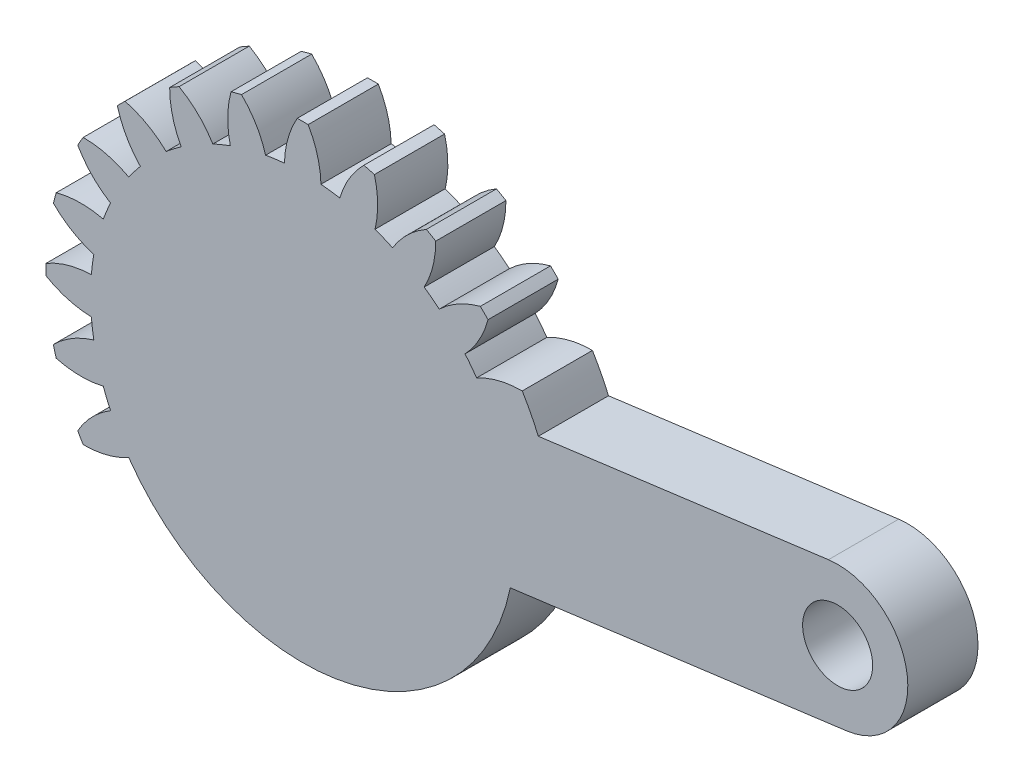
from build123d import *

# Parameters (mm, degrees)
SKETCH2_R           = 1.75
SKETCH2_R_2         = 1.995
BOSS_EXTRUDE1_DEPTH = 4
SKETCH4_R           = 1.3
SKETCH4_R_2         = 2.4
CUT_EXTRUDE1_DEPTH  = 38.915688046
SKETCH6_R           = 12.09
BOSS_EXTRUDE3_DEPTH = 4
CUT_EXTRUDE5_DEPTH  = 4
SKETCH10_W          = 77.083207297
SKETCH10_H          = 41.615870942
CUT_EXTRUDE6_DEPTH  = 4
CIRPATTERN3_START   = 4
CIRPATTERN3_DEPTH   = 4
SKETCH11_R          = 1.995
CUT_EXTRUDE7_DEPTH  = 4
CUT_EXTRUDE8_DEPTH  = 4


# Read off the part's stored shape, not the designer's step: CirPattern3
with BuildPart() as part:
    # Sketch2 → Boss-Extrude1 (new body)
    with BuildSketch(Plane.XY):
        with BuildLine():
            ThreePointArc((30.75, -4), (34.75, 0), (30.75, 4))
            Line((30.75, 4), (14.072558403, 4))
            ThreePointArc((14.072558403, 4), (14.06038767, 4.04257326), (14.048088143, 4.085109489))
            ThreePointArc((14.048088143, 4.085109489), (12.709169027, 4.272836063), (11.365584201, 4.122086336))
            ThreePointArc((11.365584201, 4.122086336), (11.169703548, 4.626642697), (10.951436862, 5.12192646))
            ThreePointArc((10.951436862, 5.12192646), (12.008090957, 5.965388247), (12.82210701, 7.044889767))
            ThreePointArc((12.82210701, 7.044889767), (12.669951657, 7.315), (12.51210701, 7.581825517))
            ThreePointArc((12.51210701, 7.581825517), (11.170223244, 7.416617696), (9.911436862, 6.9232593))
            ThreePointArc((9.911436862, 6.9232593), (9.591641884, 7.359925677), (9.252623584, 7.781841479))
            ThreePointArc((9.252623584, 7.781841479), (10.05496909, 8.870045207), (10.561852666, 10.123446462))
            ThreePointArc((10.561852666, 10.123446462), (10.344972209, 10.344972209), (10.123446462, 10.561852666))
            ThreePointArc((10.123446462, 10.561852666), (8.870045207, 10.05496909), (7.781841479, 9.252623584))
            ThreePointArc((7.781841479, 9.252623584), (7.359925677, 9.591641884), (6.9232593, 9.911436862))
            ThreePointArc((6.9232593, 9.911436862), (7.416617696, 11.170223244), (7.581825517, 12.51210701))
            ThreePointArc((7.581825517, 12.51210701), (7.315, 12.669951657), (7.044889767, 12.82210701))
            ThreePointArc((7.044889767, 12.82210701), (5.965388247, 12.008090957), (5.12192646, 10.951436862))
            ThreePointArc((5.12192646, 10.951436862), (4.626642697, 11.169703548), (4.122086336, 11.365584201))
            ThreePointArc((4.122086336, 11.365584201), (4.272836063, 12.709169027), (4.085109489, 14.048088143))
            ThreePointArc((4.085109489, 14.048088143), (3.78652263, 14.131494839), (3.486235477, 14.208555951))
            ThreePointArc((3.486235477, 14.208555951), (2.654199937, 13.14288127), (2.112960617, 11.903927815))
            ThreePointArc((2.112960617, 11.903927815), (1.578061664, 11.986568374), (1.04, 12.04518576))
            ThreePointArc((1.04, 12.04518576), (0.837867713, 13.382005944), (0.31, 14.626715284))
            ThreePointArc((0.31, 14.626715284), (0, 14.63), (-0.31, 14.626715284))
            ThreePointArc((-0.31, 14.626715284), (-0.837867713, 13.382005944), (-1.04, 12.04518576))
            ThreePointArc((-1.04, 12.04518576), (-1.578061664, 11.986568374), (-2.112960617, 11.903927815))
            ThreePointArc((-2.112960617, 11.903927815), (-2.654199937, 13.14288127), (-3.486235477, 14.208555951))
            ThreePointArc((-3.486235477, 14.208555951), (-3.78652263, 14.131494839), (-4.085109489, 14.048088143))
            ThreePointArc((-4.085109489, 14.048088143), (-4.272836063, 12.709169027), (-4.122086336, 11.365584201))
            ThreePointArc((-4.122086336, 11.365584201), (-4.626642697, 11.169703548), (-5.12192646, 10.951436862))
            ThreePointArc((-5.12192646, 10.951436862), (-5.965388247, 12.008090957), (-7.044889767, 12.82210701))
            ThreePointArc((-7.044889767, 12.82210701), (-7.315, 12.669951657), (-7.581825517, 12.51210701))
            ThreePointArc((-7.581825517, 12.51210701), (-7.416617696, 11.170223244), (-6.9232593, 9.911436862))
            ThreePointArc((-6.9232593, 9.911436862), (-7.359925677, 9.591641884), (-7.781841479, 9.252623584))
            ThreePointArc((-7.781841479, 9.252623584), (-8.870045207, 10.05496909), (-10.123446462, 10.561852666))
            ThreePointArc((-10.123446462, 10.561852666), (-10.344972209, 10.344972209), (-10.561852666, 10.123446462))
            ThreePointArc((-10.561852666, 10.123446462), (-10.05496909, 8.870045207), (-9.252623584, 7.781841479))
            ThreePointArc((-9.252623584, 7.781841479), (-9.591641884, 7.359925677), (-9.911436862, 6.9232593))
            ThreePointArc((-9.911436862, 6.9232593), (-11.170223244, 7.416617696), (-12.51210701, 7.581825517))
            ThreePointArc((-12.51210701, 7.581825517), (-12.669951657, 7.315), (-12.82210701, 7.044889767))
            ThreePointArc((-12.82210701, 7.044889767), (-12.008090957, 5.965388247), (-10.951436862, 5.12192646))
            ThreePointArc((-10.951436862, 5.12192646), (-11.169703548, 4.626642697), (-11.365584201, 4.122086336))
            ThreePointArc((-11.365584201, 4.122086336), (-12.709169027, 4.272836063), (-14.048088143, 4.085109489))
            ThreePointArc((-14.048088143, 4.085109489), (-14.131494839, 3.78652263), (-14.208555951, 3.486235477))
            ThreePointArc((-14.208555951, 3.486235477), (-13.14288127, 2.654199937), (-11.903927815, 2.112960617))
            ThreePointArc((-11.903927815, 2.112960617), (-11.986568374, 1.578061664), (-12.04518576, 1.04))
            ThreePointArc((-12.04518576, 1.04), (-13.382005944, 0.837867713), (-14.626715284, 0.31))
            ThreePointArc((-14.626715284, 0.31), (-14.63, 0), (-14.626715284, -0.31))
            ThreePointArc((-14.626715284, -0.31), (-13.382005944, -0.837867713), (-12.04518576, -1.04))
            ThreePointArc((-12.04518576, -1.04), (-11.986568374, -1.578061664), (-11.903927815, -2.112960617))
            ThreePointArc((-11.903927815, -2.112960617), (-13.14288127, -2.654199937), (-14.208555951, -3.486235477))
            ThreePointArc((-14.208555951, -3.486235477), (-14.131494839, -3.78652263), (-14.048088143, -4.085109489))
            ThreePointArc((-14.048088143, -4.085109489), (-12.709169027, -4.272836063), (-11.365584201, -4.122086336))
            ThreePointArc((-11.365584201, -4.122086336), (0.064808849, -12.089826294), (11.409123542, -4))
            Line((11.409123542, -4), (30.75, -4))
        make_face()
        Circle(SKETCH2_R, mode=Mode.SUBTRACT)
        with Locations((30.75, 0)):
            Circle(SKETCH2_R_2, mode=Mode.SUBTRACT)
    extrude(amount=BOSS_EXTRUDE1_DEPTH)

    # Sketch4 → Cut-Extrude1 (cut, through all)
    with BuildSketch(Plane.XY.offset(4)):
        with Locations((4.5, 0)):
            Circle(SKETCH4_R)
        with Locations((-4.5, 0)):
            Circle(SKETCH4_R)
        Circle(SKETCH4_R_2)
    extrude(amount=-CUT_EXTRUDE1_DEPTH, mode=Mode.SUBTRACT)

    # Sketch6 → Boss-Extrude3 (add)
    with BuildSketch(Plane.XY.offset(4)):
        with BuildLine():
            Line((-0.522104769, 3.965779445), (0, 4.034515842))
            Line((0, 4.034515842), (0, 12.09))
            ThreePointArc((0, 12.09), (-9.383764517, -7.623192474), (11.833621678, -2.476589993))
            Line((11.833621678, -2.476589993), (0.522104769, -3.965779445))
            ThreePointArc((0.522104769, -3.965779445), (-3.965779445, -0.522104769), (-0.522104769, 3.965779445))
        make_face()
        with BuildLine():
            Line((0, 12.09), (0, 4.034515842))
            Line((0, 4.034515842), (1.120574863, 4.182042322))
            Line((1.120574863, 4.182042322), (3.129122255, 11.67804324))
            ThreePointArc((3.129122255, 11.67804324), (1.578061664, 11.986568374), (0, 12.09))
        make_face()
        with BuildLine():
            Line((3.129122255, 11.67804324), (1.120574863, 4.182042322))
            Line((1.120574863, 4.182042322), (10.78941214, 5.454968898))
            ThreePointArc((10.78941214, 5.454968898), (7.623192474, 9.383764517), (3.129122255, 11.67804324))
        make_face()
        with BuildLine():
            Line((1.120574863, 4.182042322), (0, 0))
            Line((0, 0), (0, 4.034515842))
            Line((0, 4.034515842), (-0.522104769, 3.965779445))
            ThreePointArc((-0.522104769, 3.965779445), (-3.965779445, -0.522104769), (0.522104769, -3.965779445))
            Line((0.522104769, -3.965779445), (11.833621678, -2.476589993))
            ThreePointArc((11.833621678, -2.476589993), (12.025734615, -1.24491243), (12.09, 0))
            ThreePointArc((12.09, 0), (11.76035911, 2.80393538), (10.78941214, 5.454968898))
            Line((10.78941214, 5.454968898), (1.120574863, 4.182042322))
        make_face()
        with BuildLine():
            Line((13.430060946, 5.802616909), (10.78941214, 5.454968898))
            ThreePointArc((10.78941214, 5.454968898), (11.76035911, 2.80393538), (12.09, 0))
            ThreePointArc((12.09, 0), (12.025734615, -1.24491243), (11.833621678, -2.476589993))
            Line((11.833621678, -2.476589993), (14.474270484, -2.128941982))
            ThreePointArc((14.474270484, -2.128941982), (14.59101568, -1.067315048), (14.63, 0))
            ThreePointArc((14.63, 0), (14.32687495, 2.962693737), (13.430060946, 5.802616909))
        make_face()
        with BuildLine():
            Line((29.964824718, 7.979459856), (13.430060946, 5.802616909))
            ThreePointArc((13.430060946, 5.802616909), (14.32687495, 2.962693737), (14.63, 0))
            ThreePointArc((14.63, 0), (14.59101568, -1.067315048), (14.474270484, -2.128941982))
            Line((14.474270484, -2.128941982), (31.009034256, 0.047900965))
            ThreePointArc((31.009034256, 0.047900965), (34.452708933, 4.53578518), (29.964824718, 7.979459856))
        make_face()
        with BuildLine():
            Line((3.78652263, 14.131494839), (3.129122255, 11.67804324))
            ThreePointArc((3.129122255, 11.67804324), (7.623192474, 9.383764517), (10.78941214, 5.454968898))
            Line((10.78941214, 5.454968898), (13.430060946, 5.802616909))
            ThreePointArc((13.430060946, 5.802616909), (9.562700424, 11.07211184), (3.78652263, 14.131494839))
        make_face()
        Circle(SKETCH6_R)
        with BuildLine():
            Line((0, 0), (3.78652263, 14.131494839))
            ThreePointArc((3.78652263, 14.131494839), (1.909598192, 14.504838322), (0, 14.63))
            Line((0, 14.63), (0, 0))
        make_face()
        with BuildLine():
            ThreePointArc((11.833621678, -2.476589993), (-9.383764517, -7.623192474), (0, 12.09))
            Line((0, 12.09), (0, 14.63))
            ThreePointArc((0, 14.63), (-11.07211184, -9.562700424), (14.474270484, -2.128941982))
            Line((14.474270484, -2.128941982), (11.833621678, -2.476589993))
        make_face()
        Polygon((0, 4.034515842), (0, 0), (1.120574863, 4.182042322), align=None)
    extrude(amount=BOSS_EXTRUDE3_DEPTH)

    # Sketch7 → Cut-Extrude5 (cut)
    with BuildSketch(Plane.XY.offset(4)):
        with BuildLine():
            ThreePointArc((9.911436862, 6.9232593), (11.170223244, 7.416617696), (12.51210701, 7.581825517))
            ThreePointArc((12.51210701, 7.581825517), (11.606759368, 8.906179706), (10.561852666, 10.123446462))
            ThreePointArc((10.561852666, 10.123446462), (10.05496909, 8.870045207), (9.252623584, 7.781841479))
            ThreePointArc((9.252623584, 7.781841479), (9.591641884, 7.359925677), (9.911436862, 6.9232593))
        make_face()
    extrude(amount=CUT_EXTRUDE5_DEPTH, mode=Mode.SUBTRACT)

    # Sketch10 → Cut-Extrude6 (cut)
    # profile 1 of 2: a face of its own
    with BuildSketch(Plane(origin=(0, 0, 0), x_dir=(-1, 0, 0), z_dir=(0, 0, -1))):
        with Locations((-5.704161283, 1.736795553)):
            Rectangle(SKETCH10_W, SKETCH10_H)
        Polygon((-12.51210701, 7.581825517), (-10.123446462, 10.561852666), (0, 0), align=None, mode=Mode.SUBTRACT)
    # profile 2 of 2: a face of its own
    with BuildSketch(Plane(origin=(0, 0, 0), x_dir=(-1, 0, 0), z_dir=(0, 0, -1))):
        Polygon((-10.123446462, 10.561852666), (0, 0), (-12.51210701, 7.581825517), align=None)
    extrude(amount=-CUT_EXTRUDE6_DEPTH, mode=Mode.SUBTRACT)

    # CirPattern3 outline → CirPattern3 (cut)
    with BuildSketch(Plane.XY.offset(CIRPATTERN3_START)):
        with BuildLine():
            ThreePointArc((-12.82210701, -7.044889767), (-12.008090957, -5.965388247), (-10.951436862, -5.12192646))
            ThreePointArc((-10.951436862, -5.12192646), (-11.169703548, -4.626642697), (-11.365584201, -4.122086336))
            ThreePointArc((-11.365584201, -4.122086336), (-12.709169027, -4.272836063), (-14.048088143, -4.085109489))
            ThreePointArc((-14.048088143, -4.085109489), (-13.516357561, -5.598658615), (-12.82210701, -7.044889767))
        make_face()
        with BuildLine():
            ThreePointArc((10.123446462, 10.561852666), (8.906179707, 11.606759369), (7.581825517, 12.51210701))
            ThreePointArc((7.581825517, 12.51210701), (7.416617696, 11.170223245), (6.9232593, 9.911436862))
            ThreePointArc((6.9232593, 9.911436862), (7.359925677, 9.591641884), (7.781841479, 9.252623584))
            ThreePointArc((7.781841479, 9.252623584), (8.870045207, 10.05496909), (10.123446462, 10.561852666))
        make_face()
        with BuildLine():
            ThreePointArc((7.044889767, 12.82210701), (5.598658616, 13.516357561), (4.085109489, 14.048088143))
            ThreePointArc((4.085109489, 14.048088143), (4.272836063, 12.709169027), (4.122086336, 11.365584201))
            ThreePointArc((4.122086336, 11.365584201), (4.626642697, 11.169703548), (5.12192646, 10.951436862))
            ThreePointArc((5.12192646, 10.951436862), (5.965388247, 12.008090957), (7.044889767, 12.82210701))
        make_face()
        with BuildLine():
            ThreePointArc((3.486235477, 14.208555951), (1.909598192, 14.504838322), (0.31, 14.626715284))
            ThreePointArc((0.31, 14.626715284), (0.837867713, 13.382005944), (1.04, 12.04518576))
            ThreePointArc((1.04, 12.04518576), (1.578061664, 11.986568374), (2.112960617, 11.903927815))
            ThreePointArc((2.112960617, 11.903927815), (2.654199937, 13.14288127), (3.486235477, 14.208555951))
        make_face()
        with BuildLine():
            ThreePointArc((-0.31, 14.626715284), (-1.909598192, 14.504838322), (-3.486235477, 14.208555951))
            ThreePointArc((-3.486235477, 14.208555951), (-2.654199937, 13.14288127), (-2.112960617, 11.903927815))
            ThreePointArc((-2.112960617, 11.903927815), (-1.578061664, 11.986568374), (-1.04, 12.04518576))
            ThreePointArc((-1.04, 12.04518576), (-0.837867713, 13.382005944), (-0.31, 14.626715284))
        make_face()
        with BuildLine():
            ThreePointArc((-4.085109489, 14.048088143), (-5.598658616, 13.516357561), (-7.044889767, 12.82210701))
            ThreePointArc((-7.044889767, 12.82210701), (-5.965388247, 12.008090957), (-5.12192646, 10.951436862))
            ThreePointArc((-5.12192646, 10.951436862), (-4.626642697, 11.169703548), (-4.122086336, 11.365584201))
            ThreePointArc((-4.122086336, 11.365584201), (-4.272836063, 12.709169027), (-4.085109489, 14.048088143))
        make_face()
        with BuildLine():
            ThreePointArc((-7.581825517, 12.51210701), (-8.906179706, 11.606759368), (-10.123446462, 10.561852666))
            ThreePointArc((-10.123446462, 10.561852666), (-8.870045207, 10.05496909), (-7.781841479, 9.252623584))
            ThreePointArc((-7.781841479, 9.252623584), (-7.359925677, 9.591641884), (-6.9232593, 9.911436862))
            ThreePointArc((-6.9232593, 9.911436862), (-7.416617696, 11.170223245), (-7.581825517, 12.51210701))
        make_face()
        with BuildLine():
            ThreePointArc((-10.561852666, 10.123446462), (-11.606759368, 8.906179706), (-12.51210701, 7.581825517))
            ThreePointArc((-12.51210701, 7.581825517), (-11.170223245, 7.416617696), (-9.911436862, 6.9232593))
            ThreePointArc((-9.911436862, 6.9232593), (-9.591641884, 7.359925677), (-9.252623584, 7.781841479))
            ThreePointArc((-9.252623584, 7.781841479), (-10.05496909, 8.870045207), (-10.561852666, 10.123446462))
        make_face()
        with BuildLine():
            ThreePointArc((-12.82210701, 7.044889767), (-13.516357561, 5.598658616), (-14.048088143, 4.085109489))
            ThreePointArc((-14.048088143, 4.085109489), (-12.709169027, 4.272836063), (-11.365584201, 4.122086336))
            ThreePointArc((-11.365584201, 4.122086336), (-11.169703548, 4.626642697), (-10.951436862, 5.12192646))
            ThreePointArc((-10.951436862, 5.12192646), (-12.008090957, 5.965388247), (-12.82210701, 7.044889767))
        make_face()
        with BuildLine():
            ThreePointArc((-14.20855595, 3.486235477), (-14.504838322, 1.909598192), (-14.626715284, 0.31))
            ThreePointArc((-14.626715284, 0.31), (-13.382005944, 0.837867713), (-12.04518576, 1.04))
            ThreePointArc((-12.04518576, 1.04), (-11.986568374, 1.578061664), (-11.903927815, 2.112960617))
            ThreePointArc((-11.903927815, 2.112960617), (-13.14288127, 2.654199937), (-14.20855595, 3.486235477))
        make_face()
        with BuildLine():
            ThreePointArc((-14.626715284, -0.31), (-14.504838322, -1.909598192), (-14.20855595, -3.486235477))
            ThreePointArc((-14.20855595, -3.486235477), (-13.14288127, -2.654199937), (-11.903927815, -2.112960617))
            ThreePointArc((-11.903927815, -2.112960617), (-11.986568374, -1.578061664), (-12.04518576, -1.04))
            ThreePointArc((-12.04518576, -1.04), (-13.382005944, -0.837867713), (-14.626715284, -0.31))
        make_face()
    extrude(amount=CIRPATTERN3_DEPTH, mode=Mode.SUBTRACT)

    # Sketch11 → Cut-Extrude7 (cut)
    with BuildSketch(Plane.XY.offset(8)):
        with Locations((30.486929487, 4.013680411)):
            Circle(SKETCH11_R)
    extrude(amount=-CUT_EXTRUDE7_DEPTH, mode=Mode.SUBTRACT)

    # Sketch12 → Cut-Extrude8 (cut)
    with BuildSketch(Plane(origin=(0, 0, 4), x_dir=(-1, 0, 0), z_dir=(0, 0, -1))):
        with BuildLine():
            Line((-11.833621678, -2.476589993), (-14.474270484, -2.128941982))
            ThreePointArc((-14.474270484, -2.128941982), (-2.897586252, -14.340184584), (12.51210701, -7.581825517))
            ThreePointArc((12.51210701, -7.581825517), (11.170223244, -7.416617696), (9.911436862, -6.9232593))
            ThreePointArc((9.911436862, -6.9232593), (-2.42217167, -11.844880092), (-11.833621678, -2.476589993))
        make_face()
    extrude(amount=-CUT_EXTRUDE8_DEPTH, mode=Mode.SUBTRACT)


solid = part.part
